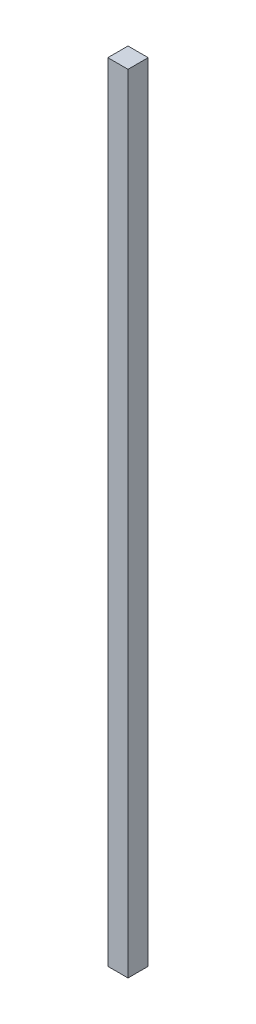
from build123d import *

# Parameters (mm, degrees)
SKETCH1_W           = 12.7
SKETCH1_H           = 12.7
BOSS_EXTRUDE1_DEPTH = 247.65


with BuildPart() as part:
    # Sketch1 → Boss-Extrude1 (new, symmetric)
    with BuildSketch(Plane(origin=(0, 0, 0), x_dir=(1, 0, 0), z_dir=(0, 1, 0))):
        Rectangle(SKETCH1_W, SKETCH1_H)
    extrude(amount=BOSS_EXTRUDE1_DEPTH, both=True)


solid = part.part
